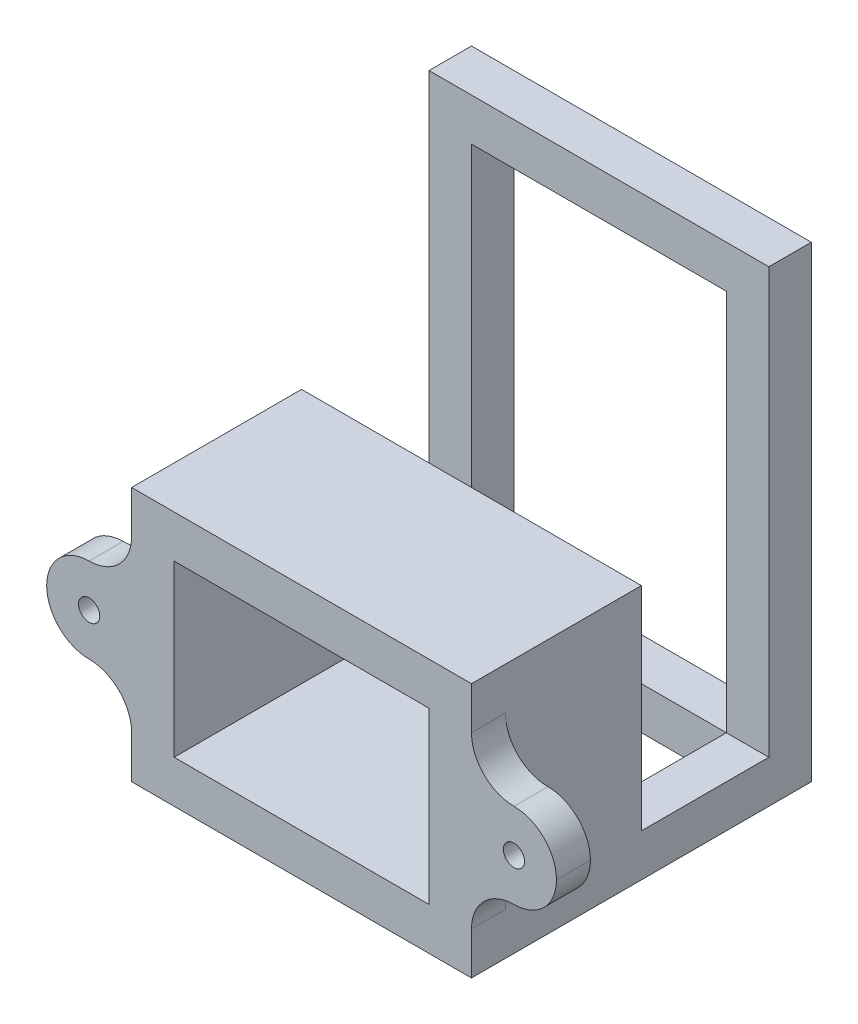
from build123d import *

# Parameters (mm, degrees)
SKETCH1_W           = 40
SKETCH1_H           = 30
SKETCH1_W_2         = 30
SKETCH1_H_2         = 20
BOSS_EXTRUDE1_DEPTH = 20
SKETCH2_W           = 10
SKETCH2_H           = 10
SKETCH2_R           = 1.25
BOSS_EXTRUDE2_DEPTH = 4
FILLET1_START       = 16
FILLET1_DEPTH       = 4
FILLET1_2_DEPTH     = 4
SKETCH3_W           = 40
SKETCH3_H           = 20
SKETCH3_W_2         = 30
SKETCH3_H_2         = 10.847900724
BOSS_EXTRUDE3_DEPTH = 5
SKETCH4_W           = 15
SKETCH4_H           = 5
BOSS_EXTRUDE4_DEPTH = 5


with BuildPart() as part:
    # Sketch1 → Boss-Extrude1 (new body)
    with BuildSketch(Plane.XY):
        Rectangle(SKETCH1_W, SKETCH1_H)
        Rectangle(SKETCH1_W_2, SKETCH1_H_2, mode=Mode.SUBTRACT)
    extrude(amount=BOSS_EXTRUDE1_DEPTH)

    # Sketch2 → Boss-Extrude2 (add)
    # profile 1 of 2: a face of its own
    with BuildSketch(Plane.XY.offset(20)):
        with Locations((-25, 0)):
            Rectangle(SKETCH2_W, SKETCH2_H)
        with Locations((-25, 0)):
            Circle(SKETCH2_R, mode=Mode.SUBTRACT)
    # profile 2 of 2: a face of its own
    with BuildSketch(Plane.XY.offset(20)):
        with Locations((25, 0)):
            Rectangle(SKETCH2_W, SKETCH2_H)
        with Locations(Location((25, 0, 0), (0, 0, 180))):
            Circle(SKETCH2_R, mode=Mode.SUBTRACT)
    extrude(amount=-BOSS_EXTRUDE2_DEPTH)

    # Fillet1: read off the stored shape, not the designer's step
    # Fillet1 outline → Fillet1 (cut)
    with BuildSketch(Plane.XY.offset(FILLET1_START)):
        with BuildLine():
            ThreePointArc((30, 0), (28.535533906, -3.535533906), (25, -5))
            Line((25, -5), (30, -5))
            Line((30, -5), (30, 0))
        make_face()
        with BuildLine():
            ThreePointArc((25, 5), (28.535533906, 3.535533906), (30, 0))
            Line((30, 0), (30, 5))
            Line((30, 5), (25, 5))
        make_face()
        with BuildLine():
            ThreePointArc((-30, 0), (-28.535533906, 3.535533906), (-25, 5))
            Line((-25, 5), (-30, 5))
            Line((-30, 5), (-30, 0))
        make_face()
        with BuildLine():
            ThreePointArc((-25, -5), (-28.535533906, -3.535533906), (-30, 0))
            Line((-30, 0), (-30, -5))
            Line((-30, -5), (-25, -5))
        make_face()
    extrude(amount=FILLET1_DEPTH, mode=Mode.SUBTRACT)

    # Fillet1 2 outline → Fillet1 2 (add)
    with BuildSketch(Plane.XY.offset(FILLET1_START)):
        with BuildLine():
            ThreePointArc((20, -10), (21.464466094, -6.464466094), (25, -5))
            Line((25, -5), (20, -5))
            Line((20, -5), (20, -10))
        make_face()
        with BuildLine():
            Line((20, 5), (25, 5))
            ThreePointArc((25, 5), (21.464466094, 6.464466094), (20, 10))
            Line((20, 10), (20, 5))
        make_face()
        with BuildLine():
            ThreePointArc((-20, 10), (-21.464466094, 6.464466094), (-25, 5))
            Line((-25, 5), (-20, 5))
            Line((-20, 5), (-20, 10))
        make_face()
        with BuildLine():
            Line((-20, -5), (-25, -5))
            ThreePointArc((-25, -5), (-21.464466094, -6.464466094), (-20, -10))
            Line((-20, -10), (-20, -5))
        make_face()
    extrude(amount=FILLET1_2_DEPTH)

    # Sketch3 → Boss-Extrude3 (add)
    with BuildSketch(Plane.XZ.offset(15)):
        with Locations((0, -10)):
            Rectangle(SKETCH3_W, SKETCH3_H)
        with Locations((0, -9.576049638)):
            Rectangle(SKETCH3_W_2, SKETCH3_H_2, mode=Mode.SUBTRACT)
    extrude(amount=-BOSS_EXTRUDE3_DEPTH)

    # Sketch4 → Boss-Extrude4 (add)
    with BuildSketch(Plane(origin=(0, 0, -20), x_dir=(-1, 0, 0), z_dir=(0, 0, -1))):
        Polygon((20, 40), (15, 40), (15, 35), (15, -10), (20, -10), align=None)
        with Locations((7.5, 37.5)):
            Rectangle(SKETCH4_W, SKETCH4_H)
        with Locations((-7.5, 37.5)):
            Rectangle(SKETCH4_W, SKETCH4_H)
        Polygon((-15, 35), (-15, 40), (-20, 40), (-20, -10), (-15, -10), align=None)
    extrude(amount=-BOSS_EXTRUDE4_DEPTH)


solid = part.part
